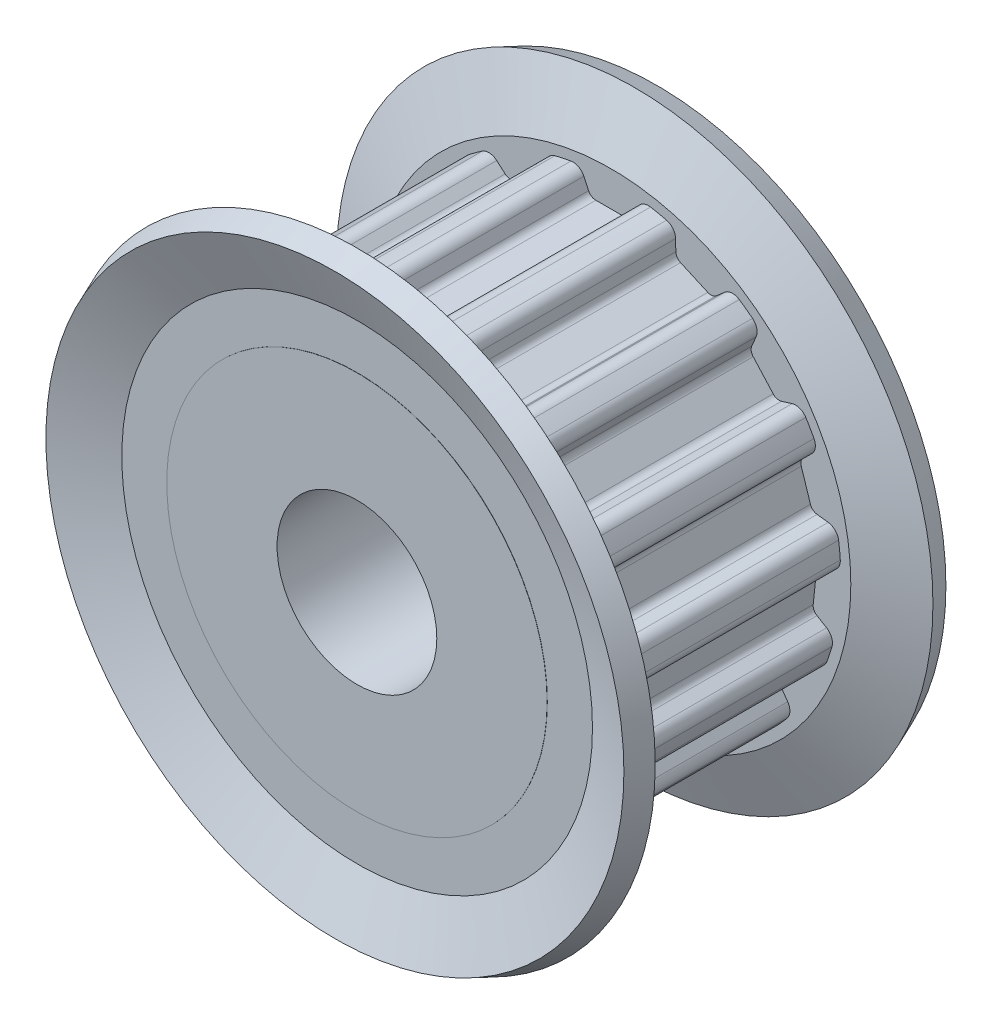
from build123d import *

# Parameters (mm, degrees)
TOOTHEXTRUDECUTGEARBELT01_DEPTH = 5.749999914
PATTERNGEARBELT01_COUNT         = 15
BOREREVOLVESKETCH_W             = 13.91999979
BOREREVOLVESKETCH_H             = 4


with BuildPart() as part:
    # SketchRevolveGearBelt01 → GearBelt01 (revolve)
    with BuildSketch(Plane(origin=(0, 0, 0), x_dir=(0, 0, -1), z_dir=(1, 0, 0))):
        Polygon((6.959999895, 0), (6.959999895, 9.524999857), (6.949999896, 9.524999857), (6.949999896, 11.786304982), (8.063312621, 14.474079664), (6.954657199, 14.933299776), (5.749999914, 12.024999819), (5.749999914, 11.525000827), (-5.749999914, 11.525000827), (-5.749999914, 12.024999819), (-6.954657199, 14.933299776), (-8.063312621, 14.474079664), (-6.949999896, 11.786304982), (-6.949999896, 9.524999857), (-6.959999895, 9.524999857), (-6.959999895, 0), align=None)
    revolve(axis=Axis((0, 0, 0), (0, 0, -1)))

    # SketchToothGearBelt01 → ToothExtrudeCutGearBelt01 (cut, symmetric)
    with BuildSketch(Plane.XY):
        with BuildLine():
            Line((-1.346605253, 11.013778629), (-1.109802523, 10.505953538))
            ThreePointArc((-1.109802523, 10.505953538), (-0.962199254, 10.337644266), (-0.747279414, 10.275000846))
            Line((-0.747279414, 10.275000846), (0.747279414, 10.275000846))
            ThreePointArc((0.747279414, 10.275000846), (0.962199254, 10.337644266), (1.109802523, 10.505953538))
            Line((1.109802523, 10.505953538), (1.346605253, 11.013778629))
            ThreePointArc((1.346605253, 11.013778629), (1.613174654, 11.292327669), (1.994209948, 11.351157242))
            Line((1.994209948, 11.351157242), (0, 13.891157204))
            Line((0, 13.891157204), (-1.994209948, 11.351157242))
            ThreePointArc((-1.994209948, 11.351157242), (-1.613174654, 11.292327669), (-1.346605253, 11.013778629))
        make_face()
    toothextrudecutgearbelt01 = extrude(amount=TOOTHEXTRUDECUTGEARBELT01_DEPTH, both=True, mode=Mode.SUBTRACT)

    # PatternGearBelt01: ToothExtrudeCutGearBelt01 ×15 about axis
    patterngearbelt01_axis = Axis((0, 0, 55), (0, 0, -1))
    for i in range(1, PATTERNGEARBELT01_COUNT):
        add(toothextrudecutgearbelt01.rotate(patterngearbelt01_axis, i * 360 / PATTERNGEARBELT01_COUNT), mode=Mode.SUBTRACT)

    # BoreRevolveSketch → BoreRevolveCut (revolve, cut)
    with BuildSketch(Plane(origin=(0, 0, 0), x_dir=(0, 0, -1), z_dir=(1, 0, 0))):
        with Locations((0, 2)):
            Rectangle(BOREREVOLVESKETCH_W, BOREREVOLVESKETCH_H)
    revolve(axis=Axis((0, 0, 0), (0, 0, -1)), mode=Mode.SUBTRACT)


solid = part.part
